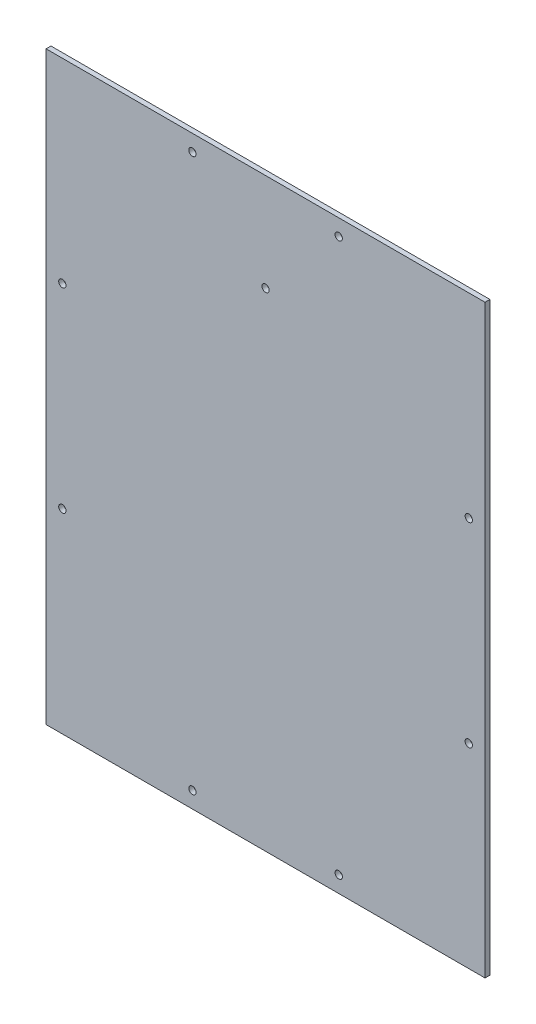
from build123d import *

# Parameters (mm, degrees)
SKETCH_1_W         = 270
SKETCH_1_H         = 360
SKETCH_1_R         = 2.25
EXTRUDE_1_DEPTH    = 3
SKETCH1_R          = 2.25
CUT_EXTRUDE1_DEPTH = 451.009999889


with BuildPart() as part:
    # Эскиз1 → Бобышка-Вытянуть1 (new body)
    with BuildSketch(Plane.XY):
        with Locations((135, 180)):
            Rectangle(SKETCH_1_W, SKETCH_1_H)
        with Locations((90, 350)):
            Circle(SKETCH_1_R, mode=Mode.SUBTRACT)
        with Locations((180, 350)):
            Circle(SKETCH_1_R, mode=Mode.SUBTRACT)
        with Locations((10, 240)):
            Circle(SKETCH_1_R, mode=Mode.SUBTRACT)
        with Locations((10, 120)):
            Circle(SKETCH_1_R, mode=Mode.SUBTRACT)
        with Locations((260, 240)):
            Circle(SKETCH_1_R, mode=Mode.SUBTRACT)
        with Locations((260, 120)):
            Circle(SKETCH_1_R, mode=Mode.SUBTRACT)
        with Locations((90, 10)):
            Circle(SKETCH_1_R, mode=Mode.SUBTRACT)
        with Locations((180, 10)):
            Circle(SKETCH_1_R, mode=Mode.SUBTRACT)
    extrude(amount=EXTRUDE_1_DEPTH)

    # Sketch1 → Cut-Extrude1 (cut, through all)
    with BuildSketch(Plane(origin=(0, 0, 0), x_dir=(-1, 0, 0), z_dir=(0, 0, -1))):
        with Locations((-135, 300)):
            Circle(SKETCH1_R)
    extrude(amount=-CUT_EXTRUDE1_DEPTH, mode=Mode.SUBTRACT)


solid = part.part
